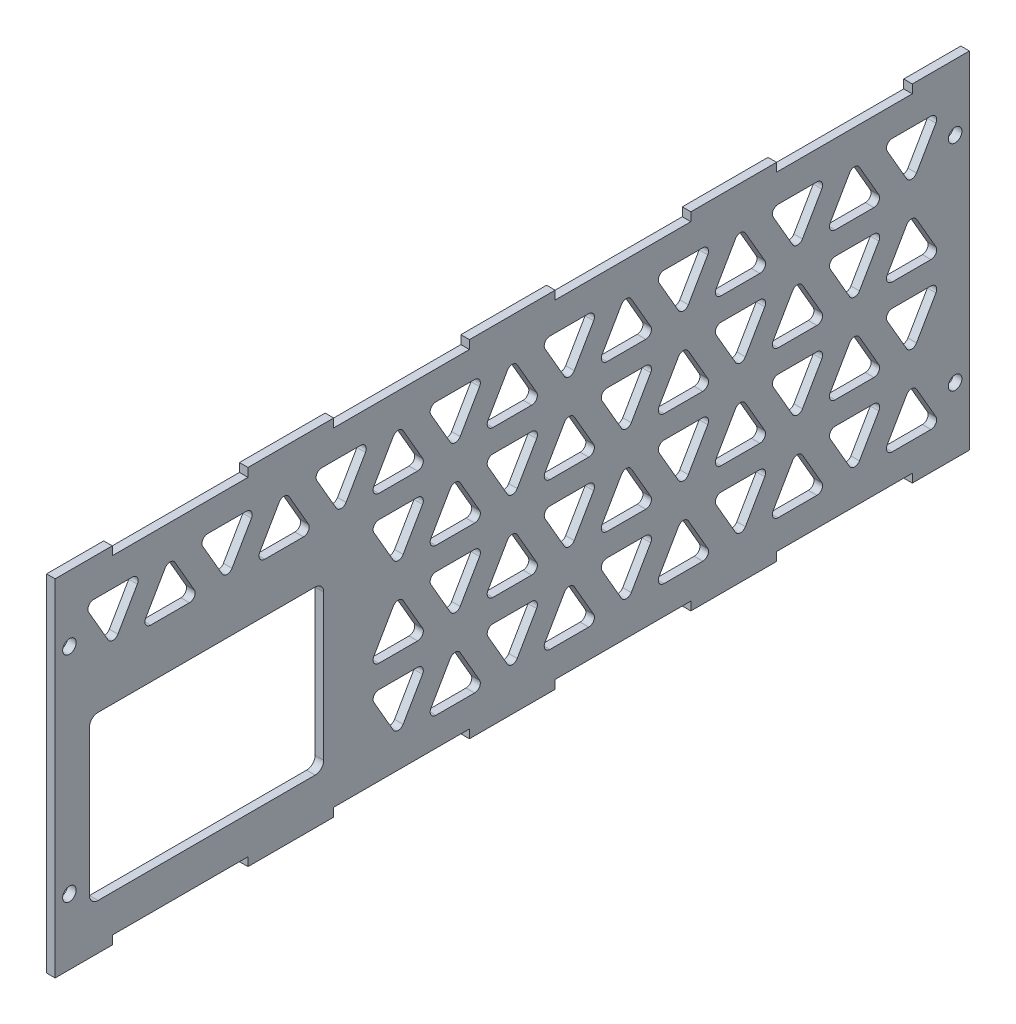
from build123d import *

# Parameters (mm, degrees)
SKETCH1_W           = 320
SKETCH1_H           = 115
BOSS_EXTRUDE1_DEPTH = 1.5
SKETCH2_W           = 20
SKETCH2_H           = 3
SKETCH2_W_2         = 30
BOSS_EXTRUDE2_DEPTH = 3
SKETCH3_W           = 82
SKETCH3_H           = 57
CUT_EXTRUDE2_DEPTH  = 172.082582398
FILLET1_R           = 3
CUT_EXTRUDE3_REACH  = 173.083
SKETCH4_R           = 2.375
CUT_EXTRUDE4_DEPTH  = 3
FILLET2_R           = 2


with BuildPart() as part:
    # Sketch1 → Boss-Extrude1 (new, symmetric)
    with BuildSketch(Plane(origin=(0, 0, 0), x_dir=(0, 0, -1), z_dir=(1, 0, 0))):
        Rectangle(SKETCH1_W, SKETCH1_H)
    extrude(amount=BOSS_EXTRUDE1_DEPTH, both=True)

    # Sketch2 → Boss-Extrude2 (add)
    with BuildSketch(Plane(origin=(1.5, 0, 0), x_dir=(0, 0, -1), z_dir=(1, 0, 0))):
        with Locations((-150, 59)):
            Rectangle(SKETCH2_W, SKETCH2_H)
        with Locations((-77.5, 59)):
            Rectangle(SKETCH2_W_2, SKETCH2_H)
        with Locations((0, 59)):
            Rectangle(SKETCH2_W_2, SKETCH2_H)
        with Locations((77.5, 59)):
            Rectangle(SKETCH2_W_2, SKETCH2_H)
        with Locations((150, 59)):
            Rectangle(SKETCH2_W, SKETCH2_H)
    boss_extrude2 = extrude(amount=-BOSS_EXTRUDE2_DEPTH)

    # Mirror1: Boss-Extrude2 across plane
    add(boss_extrude2.mirror(Plane.ZX))

    # Sketch3 → Cut-Extrude2 (cut, through all)
    with BuildSketch(Plane(origin=(1.5, 0, 0), x_dir=(0, 0, -1), z_dir=(1, 0, 0))):
        with Locations((-107, -16)):
            Rectangle(SKETCH3_W, SKETCH3_H)
    extrude(amount=-CUT_EXTRUDE2_DEPTH, mode=Mode.SUBTRACT)

    # Fillet1
    fillet1_edges = [part.edges().sort_by_distance(p)[0] for p in [
        (0, -44.5, 148),
        (0, 12.5, 148),
        (0, 12.5, 66),
        (0, -44.5, 66),
    ]]
    fillet(fillet1_edges, radius=FILLET1_R)

    # Sketch4 → Cut-Extrude3 (cut, up to next)
    with BuildSketch(Plane.ZY.offset(1.5), mode=Mode.PRIVATE) as cut_extrude3_sk1:
        with Locations((155, -37.5)):
            Circle(SKETCH4_R)
    cut_extrude3_tool1 = extrude(cut_extrude3_sk1.sketch, amount=-CUT_EXTRUDE3_REACH, mode=Mode.PRIVATE) & part.part
    # Sketch4 → Cut-Extrude3 (cut, up to next)
    with BuildSketch(Plane.ZY.offset(1.5), mode=Mode.PRIVATE) as cut_extrude3_sk2:
        with Locations((155, 37.5)):
            Circle(SKETCH4_R)
    cut_extrude3_tool2 = extrude(cut_extrude3_sk2.sketch, amount=-CUT_EXTRUDE3_REACH, mode=Mode.PRIVATE) & part.part
    # Sketch4 → Cut-Extrude3 (cut, up to next)
    with BuildSketch(Plane.ZY.offset(1.5), mode=Mode.PRIVATE) as cut_extrude3_sk3:
        with Locations((-155, -37.5)):
            Circle(SKETCH4_R)
    cut_extrude3_tool3 = extrude(cut_extrude3_sk3.sketch, amount=-CUT_EXTRUDE3_REACH, mode=Mode.PRIVATE) & part.part
    # Sketch4 → Cut-Extrude3 (cut, up to next)
    with BuildSketch(Plane.ZY.offset(1.5), mode=Mode.PRIVATE) as cut_extrude3_sk4:
        with Locations((-155, 37.5)):
            Circle(SKETCH4_R)
    cut_extrude3_tool4 = extrude(cut_extrude3_sk4.sketch, amount=-CUT_EXTRUDE3_REACH, mode=Mode.PRIVATE) & part.part
    add(cut_extrude3_tool1.solids().sort_by_distance((-1.5, -37.5, 155))[0], mode=Mode.SUBTRACT)
    add(cut_extrude3_tool2.solids().sort_by_distance((-1.5, 37.5, 155))[0], mode=Mode.SUBTRACT)
    add(cut_extrude3_tool3.solids().sort_by_distance((-1.5, -37.5, -155))[0], mode=Mode.SUBTRACT)
    add(cut_extrude3_tool4.solids().sort_by_distance((-1.5, 37.5, -155))[0], mode=Mode.SUBTRACT)

    # Sketch5 → Cut-Extrude4 (cut)
    with BuildSketch(Plane(origin=(1.5, 0, 0), x_dir=(0, 0, -1), z_dir=(1, 0, 0))):
        Polygon((-139.752032722, 29.75), (-150, 47.5), (-129.504065444, 47.5), align=None)
        Polygon((-130.035423897, 29.75), (-119.787456619, 47.5), (-109.539489341, 29.75), align=None)
        Polygon((-99.822880516, 29.75), (-110.070847794, 47.5), (-89.574913238, 47.5), align=None)
        Polygon((-90.106271691, 29.75), (-79.858304413, 47.5), (-69.610337134, 29.75), align=None)
        Polygon((-59.893728309, 29.75), (-70.141695587, 47.5), (-49.645761031, 47.5), align=None)
        Polygon((-50.177119484, 29.75), (-39.929152206, 47.5), (-29.681184928, 29.75), align=None)
        Polygon((-19.964576103, 29.75), (-30.212543381, 47.5), (-9.716608825, 47.5), align=None)
        Polygon((-10.247967278, 29.75), (0, 47.5), (10.247967278, 29.75), align=None)
        Polygon((19.964576103, 29.75), (9.716608825, 47.5), (30.212543381, 47.5), align=None)
        Polygon((29.681184928, 29.75), (39.929152206, 47.5), (50.177119484, 29.75), align=None)
        Polygon((59.893728309, 29.75), (49.645761031, 47.5), (70.141695587, 47.5), align=None)
        Polygon((69.610337134, 29.75), (79.858304413, 47.5), (90.106271691, 29.75), align=None)
        Polygon((99.822880516, 29.75), (89.574913238, 47.5), (110.070847794, 47.5), align=None)
        Polygon((109.539489341, 29.75), (119.787456619, 47.5), (130.035423897, 29.75), align=None)
        Polygon((139.752032722, 29.75), (129.504065444, 47.5), (150, 47.5), align=None)
        Polygon((139.752032722, 21.75), (129.504065444, 4), (150, 4), align=None)
        Polygon((139.752032722, -21.75), (129.504065444, -4), (150, -4), align=None)
        Polygon((139.752032722, -29.75), (129.504065444, -47.5), (150, -47.5), align=None)
        Polygon((109.539489341, -29.75), (119.787456619, -47.5), (130.035423897, -29.75), align=None)
        Polygon((109.539489341, -21.75), (119.787456619, -4), (130.035423897, -21.75), align=None)
        Polygon((109.539489341, 21.75), (119.787456619, 4), (130.035423897, 21.75), align=None)
        Polygon((99.822880516, 21.75), (89.574913238, 4), (110.070847794, 4), align=None)
        Polygon((99.822880516, -21.75), (89.574913238, -4), (110.070847794, -4), align=None)
        Polygon((99.822880516, -29.75), (89.574913238, -47.5), (110.070847794, -47.5), align=None)
        Polygon((69.610337134, -29.75), (79.858304413, -47.5), (90.106271691, -29.75), align=None)
        Polygon((69.610337134, -21.75), (79.858304413, -4), (90.106271691, -21.75), align=None)
        Polygon((69.610337134, 21.75), (79.858304413, 4), (90.106271691, 21.75), align=None)
        Polygon((59.893728309, 21.75), (49.645761031, 4), (70.141695587, 4), align=None)
        Polygon((59.893728309, -21.75), (49.645761031, -4), (70.141695587, -4), align=None)
        Polygon((59.893728309, -29.75), (49.645761031, -47.5), (70.141695587, -47.5), align=None)
        Polygon((29.681184928, -29.75), (39.929152206, -47.5), (50.177119484, -29.75), align=None)
        Polygon((29.681184928, -21.75), (39.929152206, -4), (50.177119484, -21.75), align=None)
        Polygon((29.681184928, 21.75), (39.929152206, 4), (50.177119484, 21.75), align=None)
        Polygon((19.964576103, 21.75), (9.716608825, 4), (30.212543381, 4), align=None)
        Polygon((19.964576103, -21.75), (9.716608825, -4), (30.212543381, -4), align=None)
        Polygon((19.964576103, -29.75), (9.716608825, -47.5), (30.212543381, -47.5), align=None)
        Polygon((-10.247967278, -29.75), (0, -47.5), (10.247967278, -29.75), align=None)
        Polygon((-10.247967278, -21.75), (0, -4), (10.247967278, -21.75), align=None)
        Polygon((-10.247967278, 21.75), (0, 4), (10.247967278, 21.75), align=None)
        Polygon((-19.964576103, 21.75), (-30.212543381, 4), (-9.716608825, 4), align=None)
        Polygon((-50.177119484, 21.75), (-39.929152206, 4), (-29.681184928, 21.75), align=None)
        Polygon((-50.177119484, -21.75), (-39.929152206, -4), (-29.681184928, -21.75), align=None)
        Polygon((-19.964576103, -21.75), (-30.212543381, -4), (-9.716608825, -4), align=None)
        Polygon((-19.964576103, -29.75), (-30.212543381, -47.5), (-9.716608825, -47.5), align=None)
        Polygon((-50.177119484, -29.75), (-39.929152206, -47.5), (-29.681184928, -29.75), align=None)
    extrude(amount=-CUT_EXTRUDE4_DEPTH, mode=Mode.SUBTRACT)

    # Fillet2
    fillet2_edges = [part.edges().sort_by_distance(p)[0] for p in [
        (0, -47.5, -89.574913238),
        (0, -29.75, -99.822880516),
        (0, -47.5, -110.070847794),
        (0, -47.5, -79.858304413),
        (0, -29.75, -69.610337134),
        (0, -29.75, -90.106271691),
        (0, -21.75, -99.822880516),
        (0, -4, -89.574913238),
        (0, -4, -110.070847794),
        (0, 4, -89.574913238),
        (0, 21.75, -99.822880516),
        (0, 4, -110.070847794),
        (0, 4, -119.787456619),
        (0, 21.75, -109.539489341),
        (0, 21.75, -130.035423897),
        (0, -21.75, -109.539489341),
        (0, -4, -119.787456619),
        (0, -21.75, -130.035423897),
        (0, -47.5, -129.504065444),
        (0, -29.75, -139.752032722),
        (0, -47.5, -150),
        (0, -47.5, -119.787456619),
        (0, -29.75, -109.539489341),
        (0, -29.75, -130.035423897),
        (0, 4, -39.929152206),
        (0, 21.75, -29.681184928),
        (0, 21.75, -50.177119484),
        (0, -21.75, -29.681184928),
        (0, -4, -39.929152206),
        (0, -21.75, -50.177119484),
        (0, -47.5, -49.645761031),
        (0, -29.75, -59.893728309),
        (0, -47.5, -70.141695587),
        (0, -47.5, -39.929152206),
        (0, -29.75, -29.681184928),
        (0, -29.75, -50.177119484),
        (0, -21.75, -69.610337134),
        (0, -4, -79.858304413),
        (0, -21.75, -90.106271691),
        (0, 4, -79.858304413),
        (0, 21.75, -69.610337134),
        (0, 21.75, -90.106271691),
        (0, 4, -49.645761031),
        (0, 21.75, -59.893728309),
        (0, 4, -70.141695587),
        (0, -21.75, -59.893728309),
        (0, -4, -49.645761031),
        (0, -4, -70.141695587),
        (0, 29.75, 19.964576103),
        (0, 47.5, 30.212543381),
        (0, 47.5, 9.716608825),
        (0, 29.75, 50.177119484),
        (0, 47.5, 39.929152206),
        (0, 29.75, 29.681184928),
        (0, 29.75, -19.964576103),
        (0, 47.5, -9.716608825),
        (0, 47.5, -30.212543381),
        (0, 29.75, 10.247967278),
        (0, 47.5, 0),
        (0, 29.75, -10.247967278),
        (0, 29.75, 99.822880516),
        (0, 47.5, 110.070847794),
        (0, 47.5, 89.574913238),
        (0, 29.75, 130.035423897),
        (0, 47.5, 119.787456619),
        (0, 29.75, 109.539489341),
        (0, 29.75, 59.893728309),
        (0, 47.5, 70.141695587),
        (0, 47.5, 49.645761031),
        (0, 29.75, 90.106271691),
        (0, 47.5, 79.858304413),
        (0, 29.75, 69.610337134),
        (0, -21.75, -139.752032722),
        (0, -4, -129.504065444),
        (0, -4, -150),
        (0, 4, -129.504065444),
        (0, 21.75, -139.752032722),
        (0, 4, -150),
        (0, 29.75, -109.539489341),
        (0, 47.5, -119.787456619),
        (0, 29.75, -130.035423897),
        (0, 29.75, -139.752032722),
        (0, 47.5, -129.504065444),
        (0, 47.5, -150),
        (0, 29.75, -59.893728309),
        (0, 47.5, -49.645761031),
        (0, 47.5, -70.141695587),
        (0, 29.75, -29.681184928),
        (0, 47.5, -39.929152206),
        (0, 29.75, -50.177119484),
        (0, 29.75, -99.822880516),
        (0, 47.5, -89.574913238),
        (0, 47.5, -110.070847794),
        (0, 29.75, -69.610337134),
        (0, 47.5, -79.858304413),
        (0, 29.75, -90.106271691),
        (0, -47.5, 30.212543381),
        (0, -29.75, 19.964576103),
        (0, -47.5, 9.716608825),
        (0, -47.5, 39.929152206),
        (0, -29.75, 50.177119484),
        (0, -29.75, 29.681184928),
        (0, -21.75, 50.177119484),
        (0, -4, 39.929152206),
        (0, -21.75, 29.681184928),
        (0, -21.75, 19.964576103),
        (0, -4, 30.212543381),
        (0, -4, 9.716608825),
        (0, 4, -9.716608825),
        (0, 21.75, -19.964576103),
        (0, 4, -30.212543381),
        (0, -21.75, -19.964576103),
        (0, -4, -9.716608825),
        (0, -4, -30.212543381),
        (0, -47.5, 0),
        (0, -29.75, 10.247967278),
        (0, -29.75, -10.247967278),
        (0, -47.5, -9.716608825),
        (0, -29.75, -19.964576103),
        (0, -47.5, -30.212543381),
        (0, 4, 30.212543381),
        (0, 21.75, 19.964576103),
        (0, 4, 9.716608825),
        (0, 4, 39.929152206),
        (0, 21.75, 50.177119484),
        (0, 21.75, 29.681184928),
        (0, 4, 0),
        (0, 21.75, 10.247967278),
        (0, 21.75, -10.247967278),
        (0, -21.75, 10.247967278),
        (0, -4, 0),
        (0, -21.75, -10.247967278),
        (0, 29.75, 139.752032722),
        (0, 47.5, 150),
        (0, 47.5, 129.504065444),
    ]]
    fillet(fillet2_edges, radius=FILLET2_R)


solid = part.part
